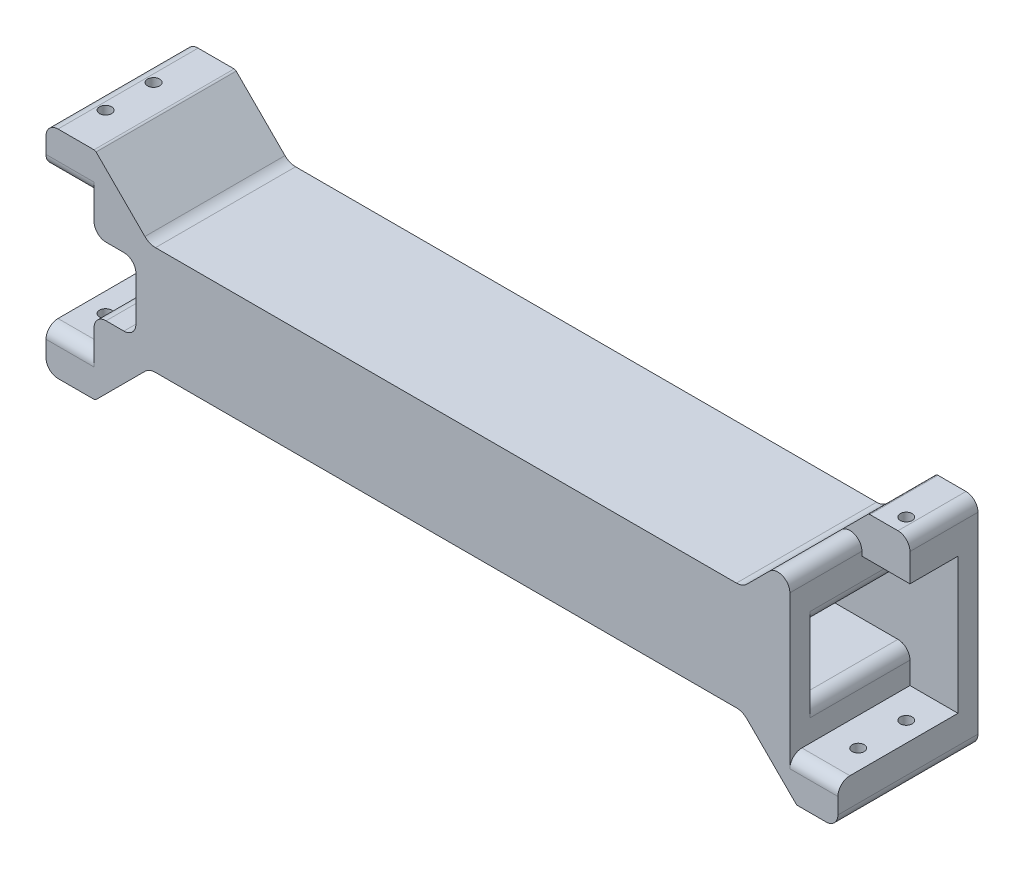
from build123d import *

# Parameters (mm, degrees)
EXTRUDE_1_DEPTH          = 35
SKETCH_2_W               = 25
SKETCH_2_H               = 17
CUT_EXTRUDE_1_DEPTH      = 209.853427677
SKETCH_3_W               = 25
SKETCH_3_H               = 8.5
CUT_EXTRUDE_2_DEPTH      = 12
FILLET_1_R               = 3
CUT_EXTRUDE_3_DEPTH      = 244.626843427
CUT_EXTRUDE_3_DEPTH_BACK = 244.626843427
SKETCH_4_R               = 1.5
SKETCH_5_W               = 12
SKETCH_5_H               = 34
CUT_EXTRUDE_4_DEPTH      = 10
FILLET_2_R               = 3
CUT_EXTRUDE_6_DEPTH      = 18
FILLET_3_R               = 3
CUT_EXTRUDE_8_DEPTH      = 10
FILLET_4_R               = 3
SKETCH_9_R               = 1.5
CUT_EXTRUDE_9_DEPTH      = 8
CUT_EXTRUDE_10_DEPTH     = 8
FILLET_5_R               = 3


with BuildPart() as part:
    # 草图1 → 凸台-拉伸1 (new body)
    with BuildSketch(Plane.XY):
        with BuildLine():
            Line((49.121689234, 57), (37.121689234, 57))
            Line((37.121689234, 57), (37.121689234, 3))
            Line((37.121689234, 3), (49.121689234, 3))
            ThreePointArc((49.121689234, 3), (49.40357385, 3.056070336), (49.642544089, 3.215745145))
            Line((49.642544089, 3.215745145), (61.832374142, 15.405575199))
            ThreePointArc((61.832374142, 15.405575199), (63.044614428, 16.215568261), (64.474549341, 16.5))
            Line((64.474549341, 16.5), (209.621689234, 16.5))
            ThreePointArc((209.621689234, 16.5), (211.051624147, 16.215568261), (212.263864432, 15.405575199))
            Line((212.263864432, 15.405575199), (224.453694486, 3.215745145))
            ThreePointArc((224.453694486, 3.215745145), (224.692664725, 3.056070336), (224.974549341, 3))
            Line((224.974549341, 3), (234.974549341, 3))
            Line((234.974549341, 3), (234.974549341, 57))
            Line((234.974549341, 57), (224.974549341, 57))
            ThreePointArc((224.974549341, 57), (224.692664725, 56.943929664), (224.453694486, 56.784254855))
            Line((224.453694486, 56.784254855), (212.263864432, 44.594424801))
            ThreePointArc((212.263864432, 44.594424801), (211.051624147, 43.784431739), (209.621689234, 43.5))
            Line((209.621689234, 43.5), (64.474549341, 43.5))
            ThreePointArc((64.474549341, 43.5), (63.044614428, 43.784431739), (61.832374142, 44.594424801))
            Line((61.832374142, 44.594424801), (49.642544089, 56.784254855))
            ThreePointArc((49.642544089, 56.784254855), (49.40357385, 56.943929664), (49.121689234, 57))
        make_face()
    extrude(amount=-EXTRUDE_1_DEPTH)

    # 草图2 → 切除-拉伸1 (cut, through all)
    with BuildSketch(Plane.ZY.offset(-37.121689234)):
        with Locations((-17.5, 30)):
            Rectangle(SKETCH_2_W, SKETCH_2_H)
    extrude(amount=-CUT_EXTRUDE_1_DEPTH, mode=Mode.SUBTRACT)

    # 草图3 → 切除-拉伸2 (cut)
    with BuildSketch(Plane.ZY.offset(-37.121689234)):
        with Locations((-17.5, 42.75)):
            Rectangle(SKETCH_3_W, SKETCH_3_H)
        with Locations((-17.5, 17.25)):
            Rectangle(SKETCH_3_W, SKETCH_3_H)
    cut_extrude_2 = extrude(amount=-CUT_EXTRUDE_2_DEPTH, mode=Mode.SUBTRACT)

    # 镜向1: 切除-拉伸2 across plane
    add(cut_extrude_2.mirror(Plane.ZY.offset(-136.048119287)), mode=Mode.SUBTRACT)

    # 圆角1
    fillet_1_edges = [part.edges().sort_by_distance(p)[0] for p in [
        (222.974549341, 38.5, -17.5),
        (222.974549341, 21.5, -17.5),
        (234.974549341, 57, -17.5),
        (234.974549341, 3, -17.5),
        (37.121689234, 57, -17.5),
        (37.121689234, 3, -17.5),
        (49.121689234, 21.5, -17.5),
        (49.121689234, 38.5, -17.5),
    ]]
    fillet(fillet_1_edges, radius=FILLET_1_R)

    # 草图4 → 切除-拉伸3 (cut, two sides: drawn at the far end of the back side and taken through both)
    with BuildSketch(Plane(origin=(0, 57, 0), x_dir=(1, 0, 0), z_dir=(0, 1, 0)).offset(-CUT_EXTRUDE_3_DEPTH_BACK)):
        with Locations((42, 22)):
            Circle(SKETCH_4_R)
        with Locations((42, 10)):
            Circle(SKETCH_4_R)
        with Locations((230.048119287, 22)):
            Circle(SKETCH_4_R)
        with Locations((230.048119287, 10)):
            Circle(SKETCH_4_R)
    extrude(amount=CUT_EXTRUDE_3_DEPTH + CUT_EXTRUDE_3_DEPTH_BACK, mode=Mode.SUBTRACT)

    # 草图5 → 切除-拉伸4 (cut)
    with BuildSketch(Plane(origin=(0, 0, -5), x_dir=(-1, 0, 0), z_dir=(0, 0, -1))):
        with Locations((-228.974549341, 30)):
            Rectangle(SKETCH_5_W, SKETCH_5_H)
        with Locations((-43.121689234, 30)):
            Rectangle(SKETCH_5_W, SKETCH_5_H)
    extrude(amount=-CUT_EXTRUDE_4_DEPTH, mode=Mode.SUBTRACT)

    # 圆角2
    fillet_2_edges = [part.edges().sort_by_distance(p)[0] for p in [
        (228.974549341, 13, 0),
        (228.974549341, 47, 0),
        (43.121689234, 13, 0),
        (43.121689234, 47, 0),
    ]]
    fillet(fillet_2_edges, radius=FILLET_2_R)

    # 草图7 → 切除-拉伸6 (cut)
    with BuildSketch(Plane.XY):
        with BuildLine():
            Line((222.974549341, 47), (234.974549341, 47))
            Line((234.974549341, 47), (234.974549341, 54))
            ThreePointArc((234.974549341, 54), (234.095869685, 56.121320344), (231.974549341, 57))
            Line((231.974549341, 57), (224.974549341, 57))
            ThreePointArc((224.974549341, 57), (224.692664725, 56.943929664), (224.453694486, 56.784254855))
            Line((224.453694486, 56.784254855), (222.974549341, 55.30510971))
            Line((222.974549341, 55.30510971), (222.974549341, 47))
        make_face()
    extrude(amount=-CUT_EXTRUDE_6_DEPTH, mode=Mode.SUBTRACT)

    # 圆角3
    fillet_3_edges = [part.edges().sort_by_distance(p)[0] for p in [
        (222.974549341, 55.30510971, -9),
    ]]
    fillet(fillet_3_edges, radius=FILLET_3_R)

    # 草图8 → 切除-拉伸8 (cut)
    with BuildSketch(Plane.XY.offset(-30)):
        Polygon((49.121689234, 18.5), (49.121689234, 41.5), (49.121689234, 47), (37.121689234, 47), (37.121689234, 13), (49.121689234, 13), align=None)
    extrude(amount=-CUT_EXTRUDE_8_DEPTH, mode=Mode.SUBTRACT)

    # 圆角4
    fillet_4_edges = [part.edges().sort_by_distance(p)[0] for p in [
        (43.121689234, 13, -35),
        (43.121689234, 47, -35),
    ]]
    fillet(fillet_4_edges, radius=FILLET_4_R)

    # 草图9 → 切除-拉伸9 (cut)
    with BuildSketch(Plane(origin=(0, 0, -35), x_dir=(-1, 0, 0), z_dir=(0, 0, -1))):
        with Locations((-55.191240802, 25)):
            Circle(SKETCH_9_R)
        with Locations((-55.191240802, 35)):
            Circle(SKETCH_9_R)
    extrude(amount=-CUT_EXTRUDE_9_DEPTH, mode=Mode.SUBTRACT)

    # 草图10 → 切除-拉伸10 (cut)
    with BuildSketch(Plane(origin=(0, 0, -5), x_dir=(-1, 0, 0), z_dir=(0, 0, -1))):
        with BuildLine():
            Line((-52.121689234, 38.5), (-59.586907824, 38.5))
            Line((-59.586907824, 38.5), (-59.586907824, 21.5))
            Line((-59.586907824, 21.5), (-52.121689234, 21.5))
            ThreePointArc((-52.121689234, 21.5), (-50.00036889, 20.621320344), (-49.121689234, 18.5))
            Line((-49.121689234, 18.5), (-49.121689234, 41.5))
            ThreePointArc((-49.121689234, 41.5), (-50.00036889, 39.378679656), (-52.121689234, 38.5))
        make_face()
    extrude(amount=-CUT_EXTRUDE_10_DEPTH, mode=Mode.SUBTRACT)

    # 圆角5
    fillet_5_edges = [part.edges().sort_by_distance(p)[0] for p in [
        (59.586907824, 21.5, -2.5),
        (59.586907824, 38.5, -2.5),
    ]]
    fillet(fillet_5_edges, radius=FILLET_5_R)


solid = part.part
